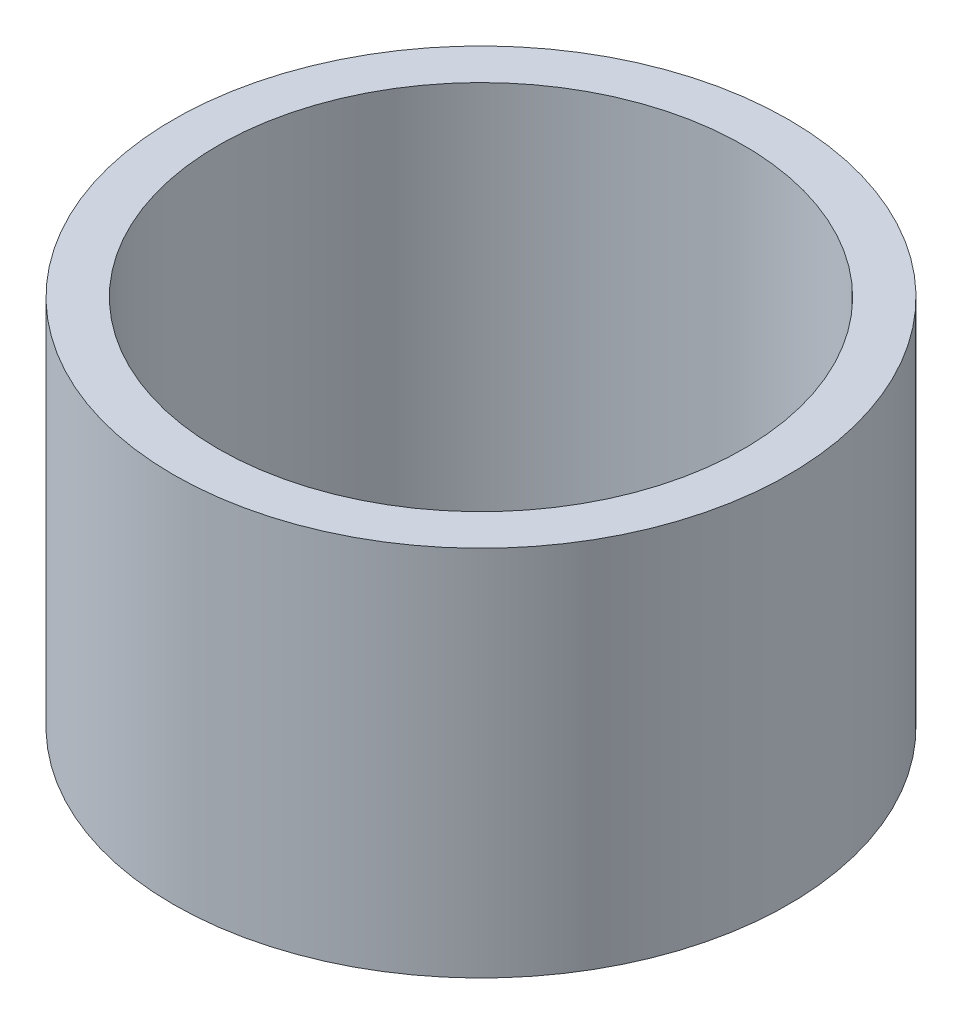
from build123d import *

# Parameters (mm, degrees)
SKETCH1_R           = 20
BOSS_EXTRUDE1_DEPTH = 24.19818979
SKETCH2_R           = 17.08723687
CUT_EXTRUDE1_DEPTH  = 38.223008867


with BuildPart() as part:
    # Sketch1 → Boss-Extrude1 (new body)
    with BuildSketch(Plane(origin=(0, 0, 0), x_dir=(1, 0, 0), z_dir=(0, 1, 0))):
        Circle(SKETCH1_R)
    extrude(amount=BOSS_EXTRUDE1_DEPTH)

    # Sketch2 → Cut-Extrude1 (cut, through all)
    with BuildSketch(Plane(origin=(0, 0, 0), x_dir=(1, 0, 0), z_dir=(0, 1, 0))):
        Circle(SKETCH2_R)
    extrude(amount=CUT_EXTRUDE1_DEPTH, mode=Mode.SUBTRACT)


solid = part.part
